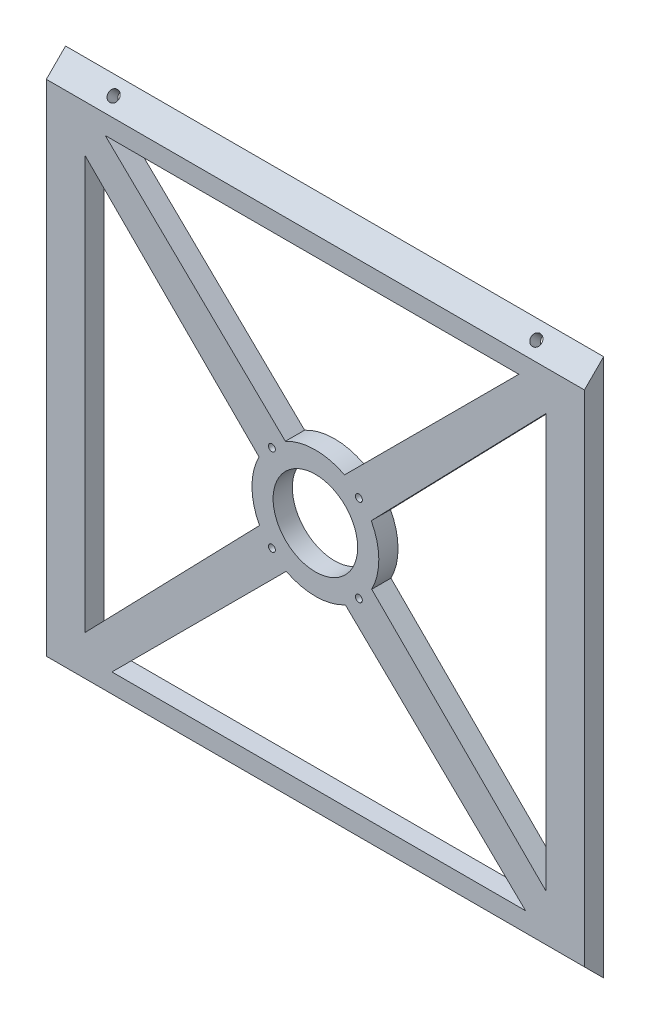
from build123d import *

# Parameters (mm, degrees)
SKETCH3_W                 = 140
SKETCH3_H                 = 140
BOSS_EXTRUDE1_DEPTH       = 5
CUT_EXTRUDE1_DEPTH        = 5
CIRPATTERN1_COUNT         = 4
CUT_EXTRUDE2_REACH        = 101.121
SKETCH7_R                 = 11
CIRPATTERN2_COUNT         = 4
CHAMFER1_SIZE             = 5
F_3_0MM_DOWEL_HOLE2_D     = 2.8
F_3_0MM_DOWEL_HOLE2_DEPTH = 10
MIRROR3_COPY_1_D          = 2.8
MIRROR3_COPY_1_DEPTH      = 10


with BuildPart() as part:
    # Sketch3 → Boss-Extrude1 (new body)
    with BuildSketch(Plane.XY):
        Rectangle(SKETCH3_W, SKETCH3_H)
    extrude(amount=BOSS_EXTRUDE1_DEPTH)

    # Sketch4 → Cut-Extrude1 (cut)
    with BuildSketch(Plane.XY.offset(5)):
        with BuildLine():
            Line((7.583144073, 14.654211885), (52.928932188, 60))
            Line((52.928932188, 60), (-54.688394727, 60))
            Line((-54.688394727, 60), (-7.80758307, 14.53587447))
            ThreePointArc((-7.80758307, 14.53587447), (-0.126862728, 16.499512291), (7.583144073, 14.654211885))
        make_face()
    cut_extrude1 = extrude(amount=-CUT_EXTRUDE1_DEPTH, mode=Mode.SUBTRACT)

    # CirPattern1: Cut-Extrude1 ×4 about axis
    cirpattern1_axis = Axis((0, 0, 0), (0, 0, 1))
    for i in range(1, CIRPATTERN1_COUNT):
        add(cut_extrude1.rotate(cirpattern1_axis, i * 360 / CIRPATTERN1_COUNT), mode=Mode.SUBTRACT)

    # Sketch7 → Cut-Extrude2 (cut, up to next)
    with BuildSketch(Plane.XY.offset(5), mode=Mode.PRIVATE) as cut_extrude2_sk1:
        Circle(SKETCH7_R)
    cut_extrude2_tool1 = extrude(cut_extrude2_sk1.sketch, amount=-CUT_EXTRUDE2_REACH, mode=Mode.PRIVATE) & part.part
    add(cut_extrude2_tool1.solids().sort_by_distance((0, 0, 5))[0], mode=Mode.SUBTRACT)

    # Sketch9 → Ø1.8 (1.8) Diameter Hole1 (revolve, cut)
    with BuildSketch(Plane(origin=(11.313708499, -11.313708499, 5), x_dir=(0, -1, 0), z_dir=(1, 0, 0))):
        Polygon((0, 0), (0, 6.540774557), (0.9, 6), (0.9, 0), align=None)
    f_1_8_1_8_diameter_hole1 = revolve(axis=Axis((11.313708499, -11.313708499, 11.35), (0, 0, -1)), mode=Mode.SUBTRACT)

    # CirPattern2: Ø1.8 (1.8) Diameter Hole1 ×4 about axis
    cirpattern2_axis = Axis((0, 0, 0), (0, 0, 1))
    for i in range(1, CIRPATTERN2_COUNT):
        add(f_1_8_1_8_diameter_hole1.rotate(cirpattern2_axis, i * 360 / CIRPATTERN2_COUNT), mode=Mode.SUBTRACT)

    # Chamfer1
    chamfer1_edges = [part.edges().sort_by_distance(p)[0] for p in [
        (0, 70, 5),
        (0, -70, 5),
    ]]
    chamfer(chamfer1_edges, length=CHAMFER1_SIZE - 0.0001)  # a hair under: the kernel refuses the full size

    # Sketch12 → Ø3.0mm Dowel Hole1 (revolve, cut)
    with BuildSketch(Plane(origin=(-70, 63, 2.5), x_dir=(0, 0, 1), z_dir=(0, 1, 0))):
        Polygon((0, 0), (0, 10.841204867), (1.4, 10), (1.4, 0), align=None)
    f_3_0mm_dowel_hole1 = revolve(axis=Axis((-76.35, 63, 2.5), (1, 0, 0)), mode=Mode.SUBTRACT)

    # Mirror1: Ø3.0mm Dowel Hole1 across plane
    add(f_3_0mm_dowel_hole1.mirror(Plane.ZX), mode=Mode.SUBTRACT)

    # Ø3.0mm Dowel Hole2
    with Locations(Plane(origin=(55, 67.5, 2.5), x_dir=(0, -0.707106781187, 0.707106781187), z_dir=(0, 0.707106781187, 0.707106781187))):
        with Locations((0, 0)):
            f_3_0mm_dowel_hole2 = Hole(F_3_0MM_DOWEL_HOLE2_D / 2, depth=F_3_0MM_DOWEL_HOLE2_DEPTH)

    # Mirror2: Ø3.0mm Dowel Hole2 across plane
    add(f_3_0mm_dowel_hole2.mirror(Plane(origin=(0, 0, 0), x_dir=(0, 0, 1), z_dir=(1, 0, 0))), mode=Mode.SUBTRACT)

    # Mirror3: Ø3.0mm Dowel Hole2 across plane
    add(f_3_0mm_dowel_hole2.mirror(Plane.ZX), mode=Mode.SUBTRACT)

    # Mirror3 copy 1
    with Locations(Plane(origin=(-55, -67.5, 2.5), x_dir=(0, 0.707106781187, 0.707106781187), z_dir=(0, -0.707106781187, 0.707106781187))):
        with Locations((0, 0)):
            Hole(MIRROR3_COPY_1_D / 2, depth=MIRROR3_COPY_1_DEPTH)


solid = part.part
